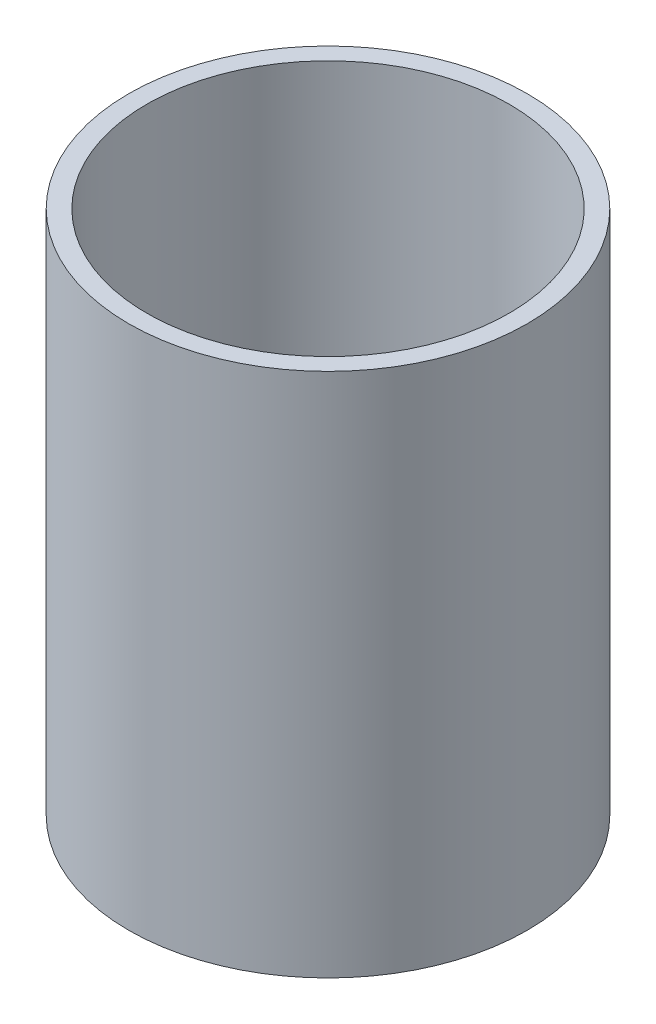
from build123d import *

# Parameters (mm, degrees)
SKETCH1_R           = 11
SKETCH1_R_2         = 10
BOSS_EXTRUDE1_DEPTH = 29


with BuildPart() as part:
    # Sketch1 → Boss-Extrude1 (new body)
    with BuildSketch(Plane(origin=(0, 0, 0), x_dir=(1, 0, 0), z_dir=(0, 1, 0))):
        Circle(SKETCH1_R)
        Circle(SKETCH1_R_2, mode=Mode.SUBTRACT)
    extrude(amount=BOSS_EXTRUDE1_DEPTH)


solid = part.part
